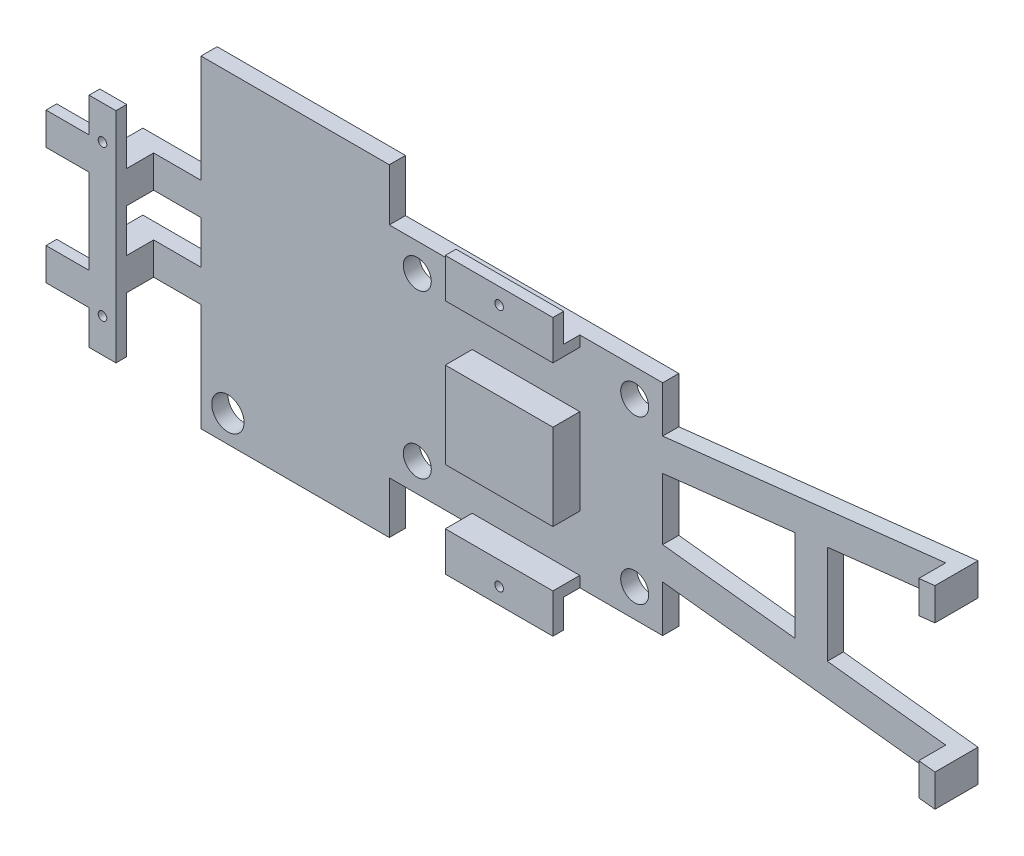
from build123d import *

# Parameters (mm, degrees)
EXTRUDE_1_DEPTH     = 10
SKETCH_2_R          = 0.4
CUT_EXTRUDE_1_DEPTH = 15.682716688
SKETCH_3_R          = 0.4
EXTRUDE_2_DEPTH     = 1
EXTRUDE_3_REACH     = 45.175
SKETCH_4_W          = 2.5
SKETCH_4_H          = 3
EXTRUDE_4_REACH     = 48.044
SKETCH_5_W          = 1.5
SKETCH_5_H          = 3
LOFT_START          = -4
LOFT_2_DEPTH        = 1.5
EXTRUDE_7_DEPTH     = 4
EXTRUDE_8_DEPTH     = 1.5
SKETCH_13_W         = 25.4
SKETCH_13_H         = 20.35
SKETCH_13_R         = 1.3
EXTRUDE_9_DEPTH     = 1.5
SKETCH_14_W         = 17.5
SKETCH_14_H         = 30
SKETCH_14_R         = 1.5
EXTRUDE_10_DEPTH    = 1.5


# Read off the part's stored shape, not the designer's step: По сечениям2
with BuildPart() as part:
    # Эскиз1 → Бобышка-Вытянуть1 (new body)
    with BuildSketch(Plane(origin=(0, 0, 0), x_dir=(0, 0, -1), z_dir=(1, 0, 0))):
        Polygon((0, 0), (0, 2.50113593), (1, 2.50113593), (1, -0.14886407), (4, -0.14886407), (4, -10.32386407), (0, -10.32386407), (0, -6.32386407), (2.5, -6.32386407), (2.5, -1.14886407), (0, -1.14886407), align=None)
    extrude_1 = extrude(amount=EXTRUDE_1_DEPTH)

    # Эскиз2 → Вырез-Вытянуть1 (cut, through all)
    with BuildSketch(Plane(origin=(0, 0, -1), x_dir=(-1, 0, 0), z_dir=(0, 0, -1))):
        with Locations(Location((-5, 1.00113593, 0), (0, 0, 90))):
            Circle(SKETCH_2_R)
    cut_extrude_1 = extrude(amount=-CUT_EXTRUDE_1_DEPTH, mode=Mode.SUBTRACT)

    # Зеркальное отражение1: Бобышка-Вытянуть1, Вырез-Вытянуть1 across plane
    add(extrude_1.mirror(Plane(origin=(10, -10.32386407, -4), x_dir=(0, 0, 1), z_dir=(0, 1, 0))))
    add(cut_extrude_1.mirror(Plane(origin=(10, -10.32386407, -4), x_dir=(0, 0, 1), z_dir=(0, 1, 0))), mode=Mode.SUBTRACT)

    # Эскиз5 → Бобышка-Вытянуть4 (add, up to next)
    with BuildSketch(Plane(origin=(-29.6, 0, 0), x_dir=(0, 0, -1), z_dir=(1, 0, 0)), mode=Mode.PRIVATE) as extrude_4_sk1:
        with Locations((3.25, -6.80386407)):
            Rectangle(SKETCH_5_W, SKETCH_5_H)
    extrude_4_tool1 = extrude(extrude_4_sk1.sketch, amount=EXTRUDE_4_REACH, mode=Mode.PRIVATE) - part.part
    # Эскиз5 → Бобышка-Вытянуть4 (add, up to next)
    with BuildSketch(Plane(origin=(-29.6, 0, 0), x_dir=(0, 0, -1), z_dir=(1, 0, 0)), mode=Mode.PRIVATE) as extrude_4_sk2:
        with Locations((3.25, -13.80386407)):
            Rectangle(SKETCH_5_W, SKETCH_5_H)
    extrude_4_tool2 = extrude(extrude_4_sk2.sketch, amount=EXTRUDE_4_REACH, mode=Mode.PRIVATE) - part.part


with BuildPart() as body_2:
    # Эскиз3 → Бобышка-Вытянуть2 (new body)
    with BuildSketch(Plane.XY.offset(1)):
        Polygon((-32.1, -0.15386407), (-32.1, -3.35386407), (-36.1, -3.35386407), (-36.1, -6.35386407), (-32.1, -6.35386407), (-32.1, -14.25386407), (-36.1, -14.25386407), (-36.1, -17.25386407), (-32.1, -17.25386407), (-32.1, -20.45386407), (-29.6, -20.45386407), (-29.6, -0.15386407), align=None)
        with Locations((-30.85, -3.30386407)):
            Circle(SKETCH_3_R, mode=Mode.SUBTRACT)
        with Locations((-30.85, -17.30386407)):
            Circle(SKETCH_3_R, mode=Mode.SUBTRACT)
    extrude(amount=-EXTRUDE_2_DEPTH)

    # Эскиз4 → Бобышка-Вытянуть3 (add, up to next)
    with BuildSketch(Plane(origin=(0, 0, -4), x_dir=(-1, 0, 0), z_dir=(0, 0, -1)), mode=Mode.PRIVATE) as extrude_3_sk1:
        with Locations((30.85, -6.80386407)):
            Rectangle(SKETCH_4_W, SKETCH_4_H)
    extrude_3_tool1 = extrude(extrude_3_sk1.sketch, amount=-EXTRUDE_3_REACH, mode=Mode.PRIVATE) - body_2.part
    # Эскиз4 → Бобышка-Вытянуть3 (add, up to next)
    with BuildSketch(Plane(origin=(0, 0, -4), x_dir=(-1, 0, 0), z_dir=(0, 0, -1)), mode=Mode.PRIVATE) as extrude_3_sk2:
        with Locations((30.85, -13.80386407)):
            Rectangle(SKETCH_4_W, SKETCH_4_H)
    extrude_3_tool2 = extrude(extrude_3_sk2.sketch, amount=-EXTRUDE_3_REACH, mode=Mode.PRIVATE) - body_2.part
    add(extrude_3_tool1.solids().sort_by_distance((-30.85, -6.803864, -4))[0])
    add(extrude_3_tool2.solids().sort_by_distance((-30.85, -13.803864, -4))[0])


with BuildPart() as part_1:
    add(part.part)

    add(body_2.part)  # Бобышка-Вытянуть4 merges body 2
    add(extrude_4_tool1.solids().sort_by_distance((-29.6, -6.803864, -3.25))[0])
    add(extrude_4_tool2.solids().sort_by_distance((-29.6, -13.803864, -3.25))[0])

    # Эскиз8 → По сечениям1 section 0
    with BuildSketch(Plane(origin=(45.5, 0, 0), x_dir=(0, 0, -1), z_dir=(1, 0, 0))):
        with BuildLine():
            Line((2.5, -1.32386407), (4, -1.32386407))
            Line((4, -1.32386407), (4, -4.32386407))
            Line((4, -4.32386407), (2.5, -4.32386407))
            Line((2.5, -4.32386407), (2.5, -1.32386407))
        make_face()
    # Эскиз7 → По сечениям1 section 1
    with BuildSketch(Plane(origin=(10, 0, 0), x_dir=(0, 0, -1), z_dir=(1, 0, 0))):
        with BuildLine():
            Line((2.5, -5.30386407), (4, -5.30386407))
            Line((4, -5.30386407), (4, -8.30386407))
            Line((4, -8.30386407), (2.5, -8.30386407))
            Line((2.5, -8.30386407), (2.5, -5.30386407))
        make_face()
    loft()

    # По сечениям2 outline → По сечениям2 (add)
    with BuildSketch(Plane.XY.offset(LOFT_START)):
        Polygon((10, -15.30386407), (45.5, -19.32386407), (45.5, -16.32386407), (10, -12.30386407), align=None)
    extrude(amount=LOFT_2_DEPTH)

    # Эскиз11 → Бобышка-Вытянуть7 (add)
    with BuildSketch(Plane(origin=(0, 0, -4), x_dir=(-1, 0, 0), z_dir=(0, 0, -1))):
        Polygon((-45.5, -1.32386407), (-44, -1.492033084), (-44, -4.492033084), (-45.5, -4.32386407), align=None)
        Polygon((-45.5, -16.32386407), (-45.5, -19.32386407), (-44, -19.154004915), (-44, -16.154004915), align=None)
    extrude(amount=-EXTRUDE_7_DEPTH)

    # Эскиз12 → Бобышка-Вытянуть8 (add)
    with BuildSketch(Plane(origin=(0, 0, -4), x_dir=(-1, 0, 0), z_dir=(0, 0, -1))):
        Polygon((-30, -6.061610549), (-33, -5.725272521), (-33, -14.908371112), (-30, -14.568652803), align=None)
    extrude(amount=-EXTRUDE_8_DEPTH)

    # Эскиз13 → Бобышка-Вытянуть9 (add)
    with BuildSketch(Plane(origin=(0, 0, -4), x_dir=(-1, 0, 0), z_dir=(0, 0, -1))):
        with Locations((-5, -10.32386407)):
            Rectangle(SKETCH_13_W, SKETCH_13_H)
        with Locations(Location((-15.1, -2.75386407, 0), (0, 0, 90))):
            Circle(SKETCH_13_R, mode=Mode.SUBTRACT)
        with Locations(Location((5.1, -2.75386407, 0), (0, 0, 270))):
            Circle(SKETCH_13_R, mode=Mode.SUBTRACT)
        with Locations(Location((5.1, -17.85386407, 0), (0, 0, 90))):
            Circle(SKETCH_13_R, mode=Mode.SUBTRACT)
        with Locations(Location((-15.1, -17.85386407, 0), (0, 0, 270))):
            Circle(SKETCH_13_R, mode=Mode.SUBTRACT)
    extrude(amount=-EXTRUDE_9_DEPTH)

    # Эскиз14 → Бобышка-Вытянуть10 (add)
    with BuildSketch(Plane(origin=(0, 0, -4), x_dir=(-1, 0, 0), z_dir=(0, 0, -1))):
        with Locations((16.45, -10.30386407)):
            Rectangle(SKETCH_14_W, SKETCH_14_H)
        with Locations(Location((22.7, -22.80386407, 0), (0, 0, 90))):
            Circle(SKETCH_14_R, mode=Mode.SUBTRACT)
    extrude(amount=-EXTRUDE_10_DEPTH)


solid = part_1.part
